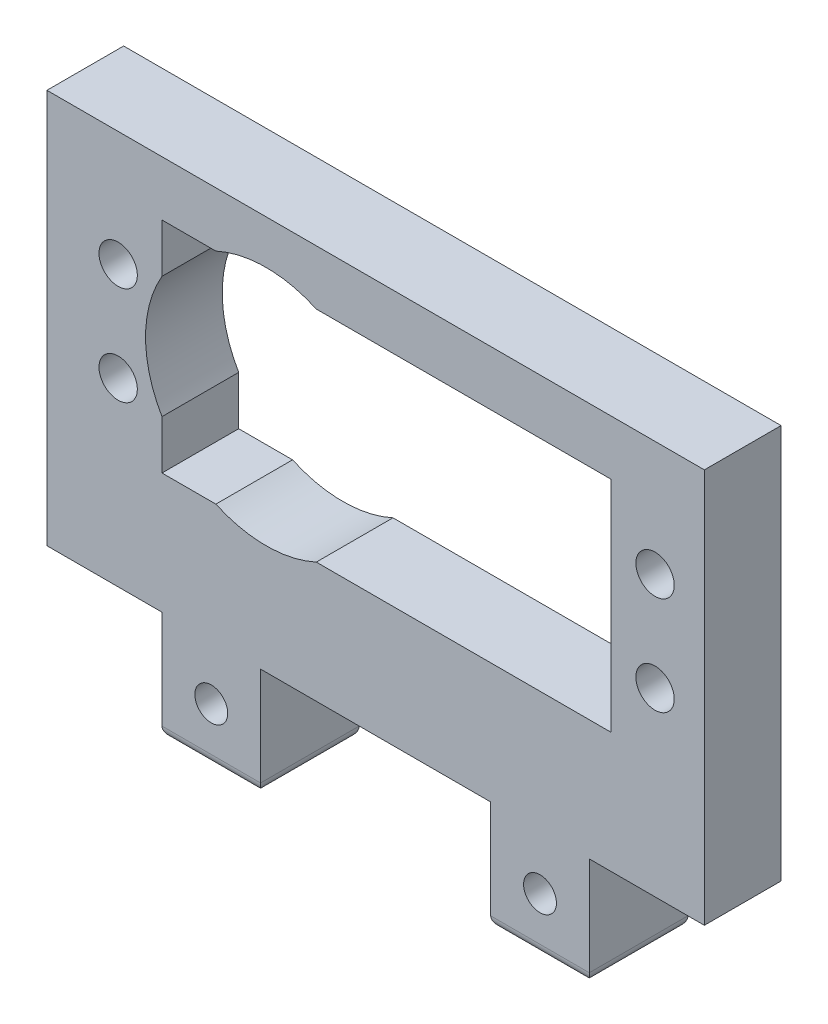
from build123d import *

# Parameters (mm, degrees)
CROQUIS1_R              = 1.75
CROQUIS1_R_2            = 1.5
SALIENTE_EXTRUIR1_DEPTH = 9
REDONDEO1_R             = 1
CROQUIS2_W              = 2
CROQUIS2_H              = 36
CORTAR_EXTRUIR1_DEPTH   = 71.547856098
REDONDEO2_R             = 3


with BuildPart() as part:
    # Croquis1 → Saliente-Extruir1 (new body)
    with BuildSketch(Plane.XY):
        Polygon((0, 36), (0, 0), (10.5, 0), (10.5, -10), (19.5, -10), (19.5, 0), (40.5, 0), (40.5, -10), (49.5, -10), (49.5, 0), (60, 0), (60, 36), align=None)
        with Locations((6.5, 16.5)):
            Circle(CROQUIS1_R, mode=Mode.SUBTRACT)
        with Locations((6.5, 25.5)):
            Circle(CROQUIS1_R, mode=Mode.SUBTRACT)
        with BuildLine():
            Line((10.5, 26.545268253), (10.5, 31))
            Line((10.5, 31), (15.417424305, 31))
            ThreePointArc((15.417424305, 31), (20, 32), (24.582575695, 31))
            Line((24.582575695, 31), (51.5, 31))
            Line((51.5, 31), (51.5, 11))
            Line((51.5, 11), (24.582575695, 11))
            ThreePointArc((24.582575695, 11), (20, 10), (15.417424305, 11))
            Line((15.417424305, 11), (10.5, 11))
            Line((10.5, 11), (10.5, 15.454731747))
            ThreePointArc((10.5, 15.454731747), (9, 21), (10.5, 26.545268253))
        make_face(mode=Mode.SUBTRACT)
        with Locations((55.5, 16.5)):
            Circle(CROQUIS1_R, mode=Mode.SUBTRACT)
        with Locations((55.5, 25.5)):
            Circle(CROQUIS1_R, mode=Mode.SUBTRACT)
        with Locations((15, -5)):
            Circle(CROQUIS1_R_2, mode=Mode.SUBTRACT)
        with Locations((45, -5)):
            Circle(CROQUIS1_R_2, mode=Mode.SUBTRACT)
    extrude(amount=SALIENTE_EXTRUIR1_DEPTH)

    # Redondeo1
    redondeo1_edges = [part.edges().sort_by_distance(p)[0] for p in [
        (45, -10, 0),
        (15, -10, 0),
        (49.5, -10, 4.5),
        (40.5, -10, 4.5),
        (19.5, -10, 4.5),
        (10.5, -10, 4.5),
        (15, -10, 9),
        (45, -10, 9),
    ]]
    fillet(redondeo1_edges, radius=REDONDEO1_R)

    # Croquis2 → Cortar-Extruir1 (cut, through all)
    with BuildSketch(Plane.ZY):
        with Locations((1, 18)):
            Rectangle(CROQUIS2_W, CROQUIS2_H)
    extrude(amount=-CORTAR_EXTRUIR1_DEPTH, mode=Mode.SUBTRACT)

    # Redondeo2
    # the kernel refuses this fillet: 3 mm, written as the material it adds along each edge
    with BuildSketch(Plane(origin=(10.5, 0, 2), x_dir=(0, 0, -1), z_dir=(1, 0, 0))) as redondeo2_piece_1:
        with BuildLine():
            CenterArc((3, 2.828427125), REDONDEO2_R, 180, 70.528779366)
            Line((0, 2.828427125), (0, 0))
            Line((0, 0), (2, 0))
        make_face()
    extrude(amount=9)
    with BuildSketch(Plane(origin=(40.5, 0, 2), x_dir=(0, 1, 0), z_dir=(1, 0, 0))) as redondeo2_piece_2:
        with BuildLine():
            CenterArc((2.828427125, -3), REDONDEO2_R, 90, 70.528779366)
            Line((0, -2), (0, 0))
            Line((0, 0), (2.828427125, 0))
        make_face()
    extrude(amount=9)


solid = part.part
